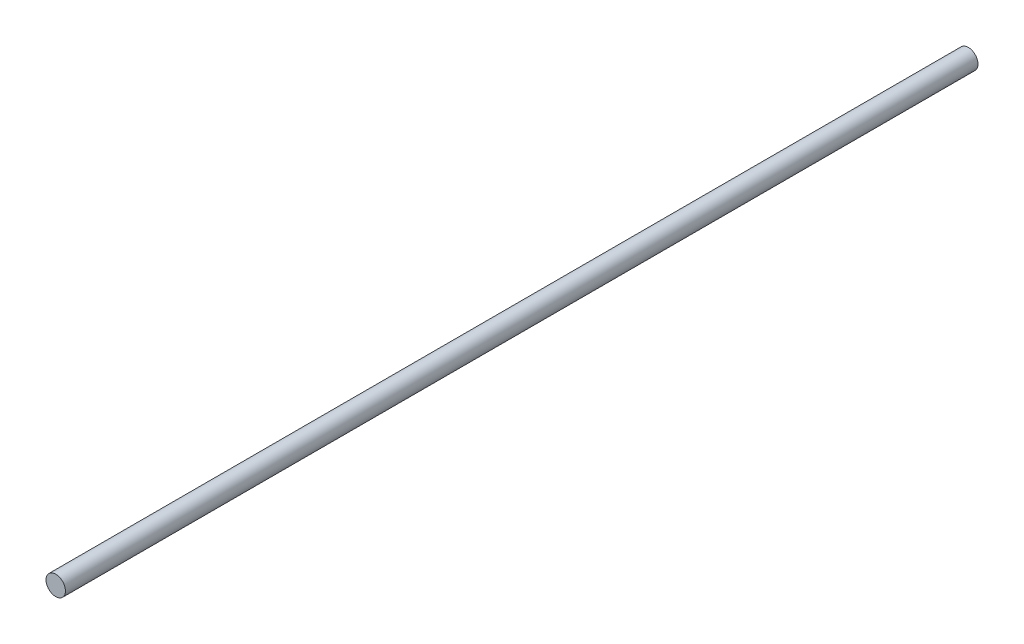
from build123d import *

# Parameters (mm, degrees)
SKETCH2_W = 375
SKETCH2_H = 4


with BuildPart() as part:
    # Sketch2 → Revolve1 (revolve)
    with BuildSketch(Plane(origin=(0, 0, 0), x_dir=(0, 0, -1), z_dir=(1, 0, 0))):
        with Locations((187.5, 2)):
            Rectangle(SKETCH2_W, SKETCH2_H)
    revolve(axis=Axis((0, 0, 0), (0, 0, -1)))


solid = part.part
